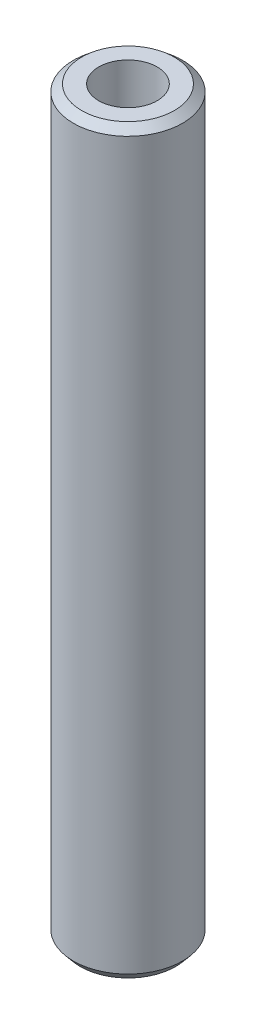
from build123d import *
from OCP.BRepFilletAPI import BRepFilletAPI_MakeChamfer

# Parameters (mm, degrees)
SKETCH1_R           = 42.5
BOSS_EXTRUDE1_DEPTH = 576.664930188
SKETCH2_R           = 22.787540385
CUT_EXTRUDE1_DEPTH  = 580.788704365
CHAMFER1_SIZE       = 5.358652758
CHAMFER1_SIZE2      = 6.428387609


with BuildPart() as part:
    # Sketch1 → Boss-Extrude1 (new body)
    with BuildSketch(Plane(origin=(0, 0, 0), x_dir=(1, 0, 0), z_dir=(0, 1, 0))):
        Circle(SKETCH1_R)
    extrude(amount=BOSS_EXTRUDE1_DEPTH)

    # Sketch2 → Cut-Extrude1 (cut, through all)
    with BuildSketch(Plane(origin=(0, 0, 0), x_dir=(1, 0, 0), z_dir=(0, 1, 0))):
        Circle(SKETCH2_R)
    extrude(amount=CUT_EXTRUDE1_DEPTH, mode=Mode.SUBTRACT)

    # Chamfer1: one chamfer whose edges measure the first distance from different faces: ONE call of the kernel's chamfer builder (chamfer() names one face for all edges)
    chamfer1_edges_1 = [part.edges().sort_by_distance(p)[0] for p in [
        (-42.5, 576.664930188, 0),
    ]]
    chamfer1_side_1 = [part.faces().sort_by_distance(p)[0] for p in [
        (-42.5, 288.332465094, 0),
    ]]
    chamfer1_edges_2 = [part.edges().sort_by_distance(p)[0] for p in [
        (-42.5, 0, 0),
    ]]
    chamfer1_side_2 = [part.faces().sort_by_distance(p)[0] for p in [
        (-41.297918472, 0, 0),
    ]]
    chamfer1 = BRepFilletAPI_MakeChamfer(part.part.solid().wrapped)
    for e in chamfer1_edges_1:
        chamfer1.Add(CHAMFER1_SIZE, CHAMFER1_SIZE2, e.wrapped, chamfer1_side_1[0].wrapped)  # the first distance lies on this face
    for e in chamfer1_edges_2:
        chamfer1.Add(CHAMFER1_SIZE, CHAMFER1_SIZE2, e.wrapped, chamfer1_side_2[0].wrapped)  # the first distance lies on this face
    add(Compound.cast(chamfer1.Shape()), mode=Mode.REPLACE)


solid = part.part
